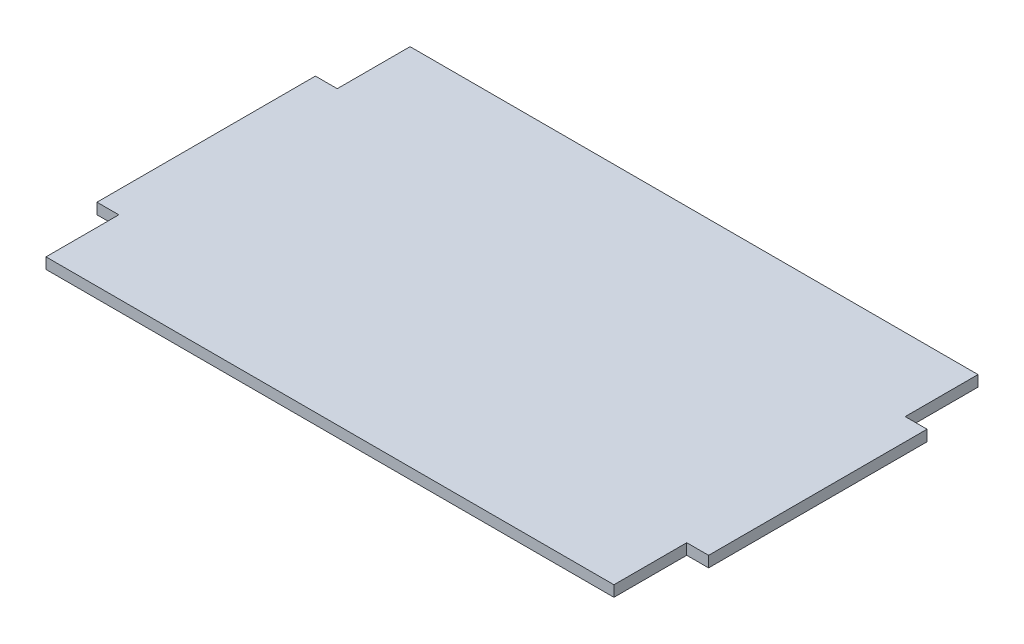
from build123d import *

# Parameters (mm, degrees)
BOSS_EXTRUDE1_DEPTH = 3


with BuildPart() as part:
    # Sketch2 → Boss-Extrude1 (new body)
    with BuildSketch(Plane(origin=(0, 0, 0), x_dir=(1, 0, 0), z_dir=(0, 1, 0))):
        Polygon((0, 0), (156, 0), (156, -20), (162, -20), (162, -80), (156, -80), (156, -100), (0, -100), (0, -80), (-6, -80), (-6, -20), (0, -20), align=None)
    extrude(amount=BOSS_EXTRUDE1_DEPTH)


solid = part.part
